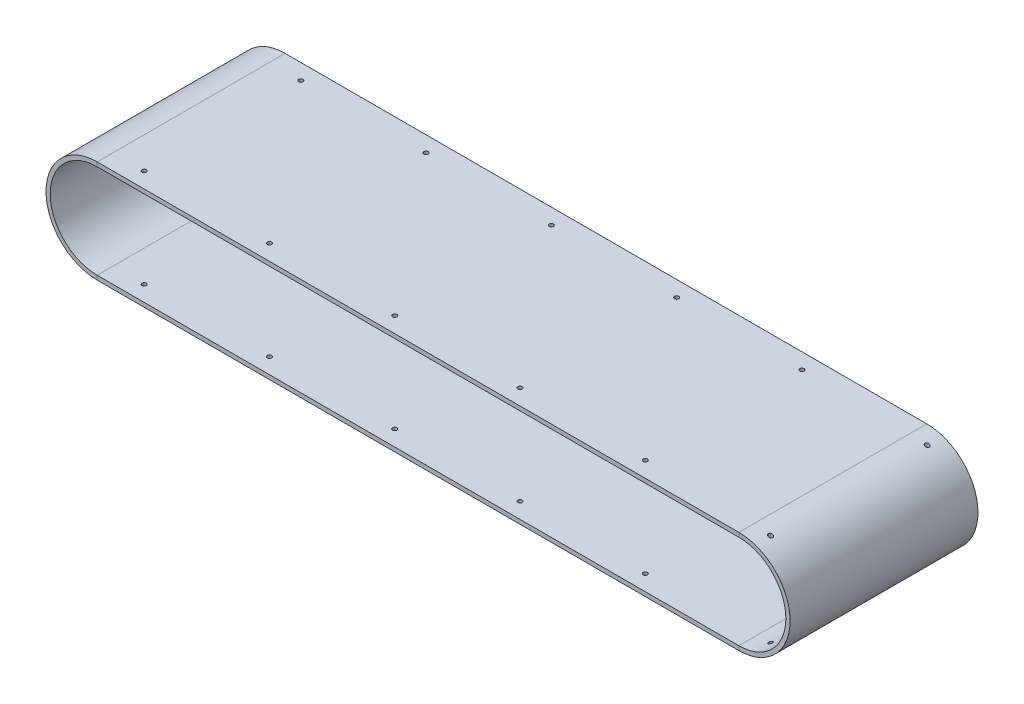
from build123d import *

# Parameters (mm, degrees)
SKETCH2_W          = 152.4
SKETCH2_H          = 3.429
SKETCH3_R          = 1.75
CUT_EXTRUDE1_DEPTH = 574.093955093


with BuildPart() as part:
    # Sweep1: sweep along a path in Sketch1
    with BuildLine(Plane.XY) as sweep1_path:
        Line((0, 39.8145), (520.371, 39.8145))
        ThreePointArc((520.371, 39.8145), (560.1855, 0), (520.371, -39.8145))
        Line((520.371, -39.8145), (0, -39.8145))
        ThreePointArc((0, -39.8145), (-39.8145, 0), (0, 39.8145))
    # Sketch2 → Sweep1 (sweep)
    with BuildSketch(Plane(origin=(0, 0, 0), x_dir=(0, 0, -1), z_dir=(1, 0, 0))):
        with Locations((0, 39.8145)):
            Rectangle(SKETCH2_W, SKETCH2_H)
    sweep(path=sweep1_path.line)

    # Sketch3 → Cut-Extrude1 (cut, through all)
    with BuildSketch(Plane(origin=(0, 41.529, 0), x_dir=(1, 0, 0), z_dir=(0, 1, 0))):
        with Locations((25.4, -63.5)):
            Circle(SKETCH3_R)
        with Locations((25.4, 63.5)):
            Circle(SKETCH3_R)
        with Locations((127, -63.5)):
            Circle(SKETCH3_R)
        with Locations((127, 63.5)):
            Circle(SKETCH3_R)
        with Locations((228.6, -63.5)):
            Circle(SKETCH3_R)
        with Locations((228.6, 63.5)):
            Circle(SKETCH3_R)
        with Locations((330.2, -63.5)):
            Circle(SKETCH3_R)
        with Locations((330.2, 63.5)):
            Circle(SKETCH3_R)
        with Locations((431.8, -63.5)):
            Circle(SKETCH3_R)
        with Locations((431.8, 63.5)):
            Circle(SKETCH3_R)
        with Locations((533.4, -63.5)):
            Circle(SKETCH3_R)
        with Locations((533.4, 63.5)):
            Circle(SKETCH3_R)
    extrude(amount=-CUT_EXTRUDE1_DEPTH, mode=Mode.SUBTRACT)


solid = part.part
